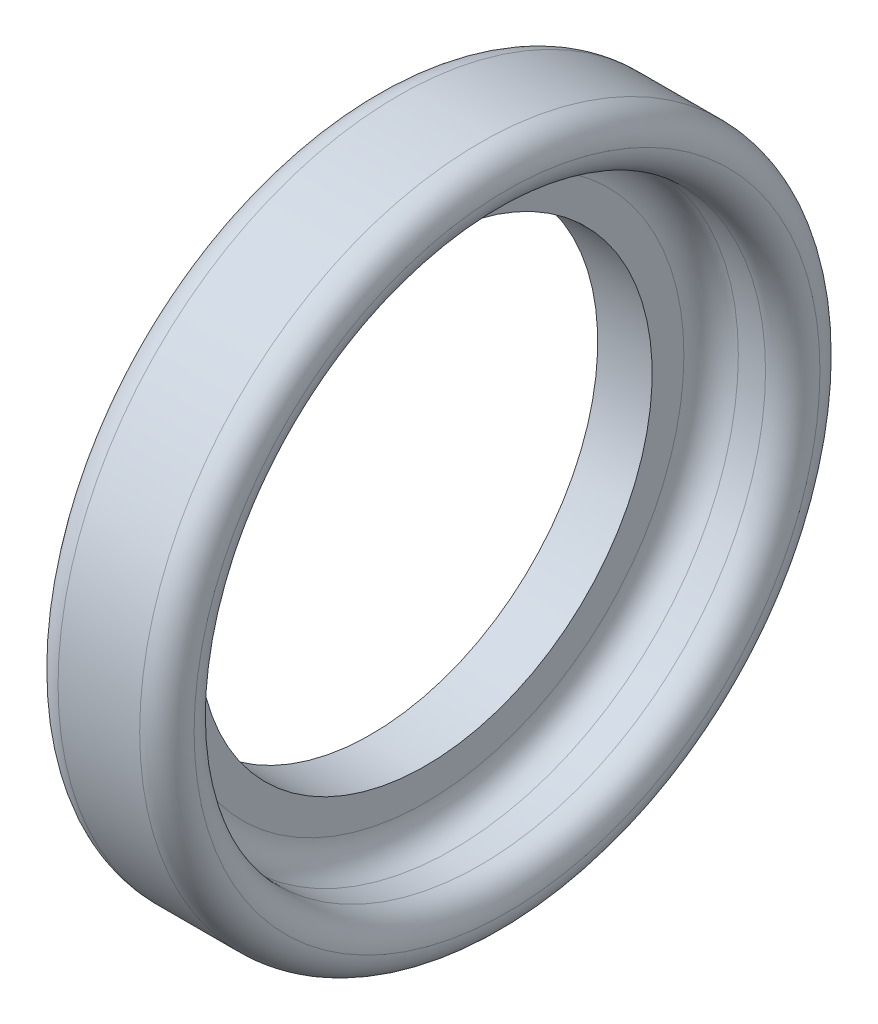
from build123d import *

# Parameters (mm, degrees)
FILLET1_R = 3
FILLET2_R = 3


with BuildPart() as part:
    # Sketch1 → Revolve1 (revolve)
    with BuildSketch(Plane.XY, mode=Mode.PRIVATE) as revolve1_sk:
        Polygon((15, 31.5), (15, 37.5), (0, 37.5), (0, 25), (6, 25), (6, 31.5), align=None)
    revolve(revolve1_sk.sketch.rotate(Axis((0, 0, 0), (1, 0, 0)), 90), axis=Axis((0, 0, 0), (1, 0, 0)))

    # Fillet1
    fillet1_edges = [part.edges().sort_by_distance(p)[0] for p in [
        (15, 0, -37.5),
        (15, 0, -31.5),
    ]]
    fillet(fillet1_edges, radius=FILLET1_R - 0.0001)  # a hair under: the kernel refuses the full size

    # Fillet2
    fillet2_edges = [part.edges().sort_by_distance(p)[0] for p in [
        (6, 0, -31.5),
        (0, 0, -37.5),
    ]]
    fillet(fillet2_edges, radius=FILLET2_R)


solid = part.part
